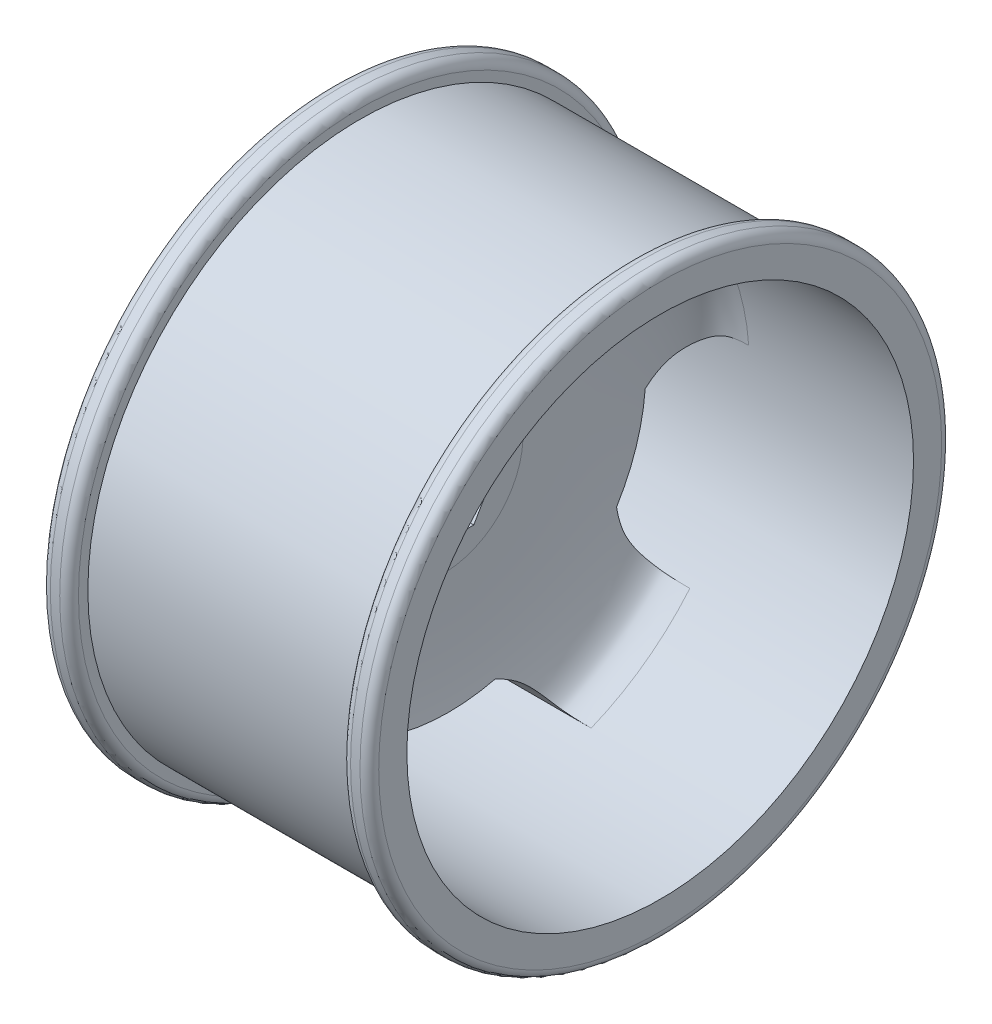
from build123d import *
from OCP.BRepFilletAPI import BRepFilletAPI_MakeFillet
from build123d.topology import SkipClean

# Parameters (mm, degrees)
CUT_EXTRUDE1_START = -15.617760157
CUT_EXTRUDE1_DEPTH = 10.557962084
CUT_EXTRUDE2_DEPTH = 4
SKETCH4_R          = 2
CUT_EXTRUDE3_DEPTH = 73.776183676
SKETCH5_R          = 7.5
CUT_EXTRUDE4_DEPTH = 4
FILLET1_R          = 5
FILLET1_R_2        = 1


# Read off the part's stored shape, not the designer's step: Cut-Extrude1
with BuildPart() as part:
    # Sketch1 → Revolve1 (revolve)
    with BuildSketch(Plane.XY, mode=Mode.PRIVATE) as revolve1_sk:
        with BuildLine():
            Line((-14.5, 0), (14.5, 0))
            Line((14.5, 0), (14.5, 2))
            Line((14.5, 2), (17.5, 2))
            Line((17.5, 2), (17.5, -2))
            Line((17.5, -2), (0, -2))
            add(Edge.make_bspline(
                [(0, -2), (-2.017311737, -2), (-6.03366083, -4.570457608), (-5.617760057, -16.168466067), (-5.617760057, -20.5)],
                knots=[0, 0, 0, 0, 0.164225232, 1, 1, 1, 1], degree=3))
            Line((-5.617760057, -20.5), (-5.617760057, -29))
            Line((-5.617760057, -29), (-15.617760057, -29))
            Line((-15.617760057, -29), (-15.617760057, -19.5))
            Line((-15.617760057, -19.5), (-14.617760057, -19.5))
            Line((-14.617760057, -19.5), (-13.559798173, -13.5))
            Line((-13.559798173, -13.5), (-11.557961884, -8))
            Line((-11.557961884, -8), (-10.557961884, -8))
            Line((-10.557961884, -8), (-9.5, -2))
            Line((-9.5, -2), (-17.5, -2))
            Line((-17.5, -2), (-17.5, 2))
            Line((-17.5, 2), (-14.5, 2))
            Line((-14.5, 2), (-14.5, 0))
        make_face()
    revolve(revolve1_sk.sketch.rotate(Axis((-15.617760057, -29, 0), (1, 0, 0)), 90), axis=Axis((-15.617760057, -29, 0), (1, 0, 0)))

    # Cut-Extrude1 outline → Cut-Extrude1 (cut)
    with SkipClean():  # the faces are left unmerged after this step: merging them gives an invalid solid
        with BuildSketch(Plane.ZY.offset(15.617760057).offset(CUT_EXTRUDE1_START)):
            with BuildLine():
                add(Edge.make_bspline(
                    [(-6.5, -2.794084637), (-6.5, -5.641426754), (-6.493570207, -7.187887666), (-8.007124363, -9.586449077)],
                    knots=[0, 0, 0, 0, 1, 1, 1, 1], degree=3))
                ThreePointArc((-6.5, -2.794084637), (-15.870201812, -7.156541152), (-22.914696108, -14.720059444))
                add(Edge.make_bspline(
                    [(-22.914696108, -14.720059444), (-20.206712834, -15.599936547), (-18.737928021, -16.083934346), (-15.989046605, -15.385655041)],
                    knots=[0, 0, 0, 0, 1, 1, 1, 1], degree=3))
                ThreePointArc((-15.989046605, -15.385655041), (-12.343490298, -12.010643118), (-8.007124363, -9.586449077))
            make_face()
            with BuildLine():
                ThreePointArc((22.914696108, -14.720059444), (15.870201812, -7.156541152), (6.5, -2.794084637))
                add(Edge.make_bspline(
                    [(6.5, -2.794084637), (6.5, -5.641426754), (6.493570207, -7.187887666), (8.007124363, -9.586449077)],
                    knots=[0, 0, 0, 0, 1, 1, 1, 1], degree=3))
                ThreePointArc((8.007124363, -9.586449077), (12.343490298, -12.010643118), (15.989046605, -15.385655041))
                add(Edge.make_bspline(
                    [(22.914696108, -14.720059444), (20.206712834, -15.599936547), (18.737928021, -16.083934346), (15.989046605, -15.385655041)],
                    knots=[0, 0, 0, 0, 1, 1, 1, 1], degree=3))
            make_face()
            with BuildLine():
                add(Edge.make_bspline(
                    [(-26.931917035, -27.083794156), (-24.223933761, -27.963671258), (-22.751175118, -28.435438865), (-20.937721614, -30.616110646)],
                    knots=[0, 0, 0, 0, 1, 1, 1, 1], degree=3))
                ThreePointArc((-26.931917035, -27.083794156), (-25.67852594, -37.343458848), (-20.662061036, -46.380426742))
                add(Edge.make_bspline(
                    [(-20.662061036, -46.380426742), (-18.988435332, -44.076878581), (-18.074246603, -42.829544759), (-17.888898613, -39.999423004)],
                    knots=[0, 0, 0, 0, 1, 1, 1, 1], degree=3))
                ThreePointArc((-17.888898613, -39.999423004), (-19.972186842, -35.489356882), (-20.937721614, -30.616110646))
            make_face()
            with BuildLine():
                ThreePointArc((20.662061036, -46.380426742), (25.67852594, -37.343458848), (26.931917035, -27.083794156))
                add(Edge.make_bspline(
                    [(26.931917035, -27.083794156), (24.223933761, -27.963671258), (22.751175118, -28.435438865), (20.937721614, -30.616110646)],
                    knots=[0, 0, 0, 0, 1, 1, 1, 1], degree=3))
                ThreePointArc((20.937721614, -30.616110646), (19.972186842, -35.489356882), (17.888898613, -39.999423004))
                add(Edge.make_bspline(
                    [(20.662061036, -46.380426742), (18.988435332, -44.076878581), (18.074246603, -42.829544759), (17.888898613, -39.999423004)],
                    knots=[0, 0, 0, 0, 1, 1, 1, 1], degree=3))
            make_face()
            with BuildLine():
                add(Edge.make_bspline(
                    [(-10.14484011, -54.021635022), (-8.471214405, -51.71808686), (-7.567429299, -50.463194364), (-4.933099241, -49.412362232)],
                    knots=[0, 0, 0, 0, 1, 1, 1, 1], degree=3))
                ThreePointArc((-10.14484011, -54.021635022), (0, -56), (10.14484011, -54.021635022))
                add(Edge.make_bspline(
                    [(10.14484011, -54.021635022), (8.471214405, -51.71808686), (7.567429299, -50.463194364), (4.933099241, -49.412362232)],
                    knots=[0, 0, 0, 0, 1, 1, 1, 1], degree=3))
                ThreePointArc((4.933099241, -49.412362232), (0, -50), (-4.933099241, -49.412362232))
            make_face()
        extrude(amount=CUT_EXTRUDE1_DEPTH, mode=Mode.SUBTRACT)
    add(part.part.scale(1), mode=Mode.REPLACE)  # the faces are merged on a copy

    # Sketch3 → Cut-Extrude2 (cut)
    with BuildSketch(Plane(origin=(-5.617760057, 0, 0), x_dir=(0, 0, -1), z_dir=(1, 0, 0))):
        Polygon((-3.25, -23.370834875), (-6.5, -29), (-3.25, -34.629165125), (3.25, -34.629165125), (6.5, -29), (3.25, -23.370834875), align=None)
    extrude(amount=-CUT_EXTRUDE2_DEPTH, mode=Mode.SUBTRACT)

    # Sketch4 → Cut-Extrude3 (cut, through all)
    with BuildSketch(Plane(origin=(-9.617760057, 0, 0), x_dir=(0, 0, -1), z_dir=(1, 0, 0))):
        with Locations((0, -29)):
            Circle(SKETCH4_R)
    extrude(amount=-CUT_EXTRUDE3_DEPTH, mode=Mode.SUBTRACT)

    # Sketch5 → Cut-Extrude4 (cut)
    with BuildSketch(Plane.ZY.offset(15.617760057)):
        with Locations((0, -29)):
            Circle(SKETCH5_R)
    extrude(amount=-CUT_EXTRUDE4_DEPTH, mode=Mode.SUBTRACT)

    # Fillet1
    fillet1_edges_1 = [part.edges().sort_by_distance(p)[0] for p in [
        (-13.559798173, -29, -15.5),
    ]]
    fillet1_edges_2 = [part.edges().sort_by_distance(p)[0] for p in [
        (-14.5, -29, -31),
        (-17.5, -29, -31),
        (-11.557961884, -29, -21),
        (-15.617760057, -29, -9.5),
        (17.5, -29, -31),
        (14.5, -29, -31),
        (-15.617760057, -29, -7.5),
    ]]
    fillet1 = BRepFilletAPI_MakeFillet(part.part.solid().wrapped)
    for e in fillet1_edges_1:
        fillet1.Add(FILLET1_R - 0.0001, e.wrapped)
    for e in fillet1_edges_2:
        fillet1.Add(FILLET1_R_2 - 0.0001, e.wrapped)
    add(Compound.cast(fillet1.Shape()), mode=Mode.REPLACE)  # a hair under: the kernel refuses the full size


solid = part.part
